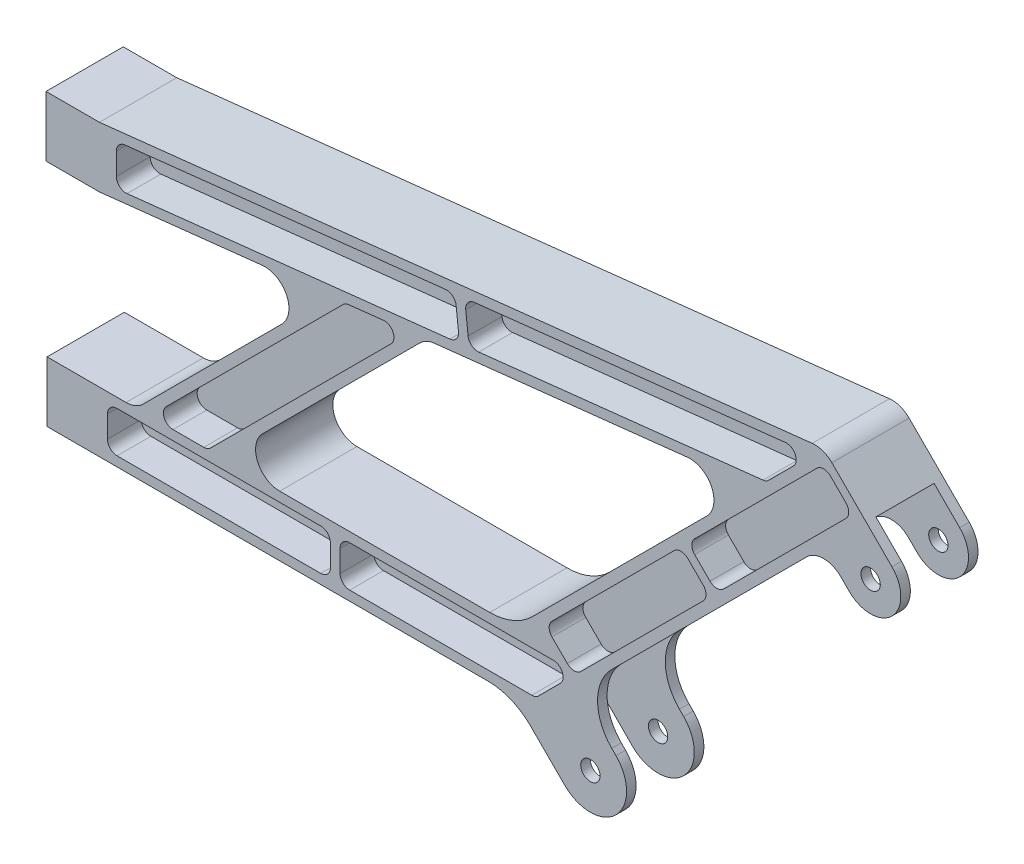
from build123d import *

# Parameters (mm, degrees)
SKETCH1_R               = 4
BOSS_EXTRUDE1_DEPTH     = 32
CUT_EXTRUDE1_DEPTH      = 14
CUT_EXTRUDE2_DEPTH      = 12.0515
CUT_EXTRUDE2_DEPTH_BACK = 12.0515


with BuildPart() as part:
    # Sketch1 → Boss-Extrude1 (new body)
    with BuildSketch(Plane.XY):
        with BuildLine():
            Line((-16.049733998, 33.731487379), (8.839559806, 8.838109599))
            ThreePointArc((8.839559806, 8.838109599), (12.499999987, -0.000512728), (8.838834763, -8.838834767))
            ThreePointArc((8.838834763, -8.838834767), (-2e-09, -12.5), (-8.838834765, -8.838834765))
            Line((-8.838834765, -8.838834765), (-12.374368672, -5.303300858))
            ThreePointArc((-12.374368672, -5.303300858), (-19.445436483, -2.37436867), (-26.516504295, -5.303300858))
            Line((-26.516504295, -5.303300858), (-107.248737345, -86.035533908))
            ThreePointArc((-107.248737345, -86.035533908), (-113.106601722, -100.177669532), (-107.248737345, -114.319805156))
            Line((-107.248737345, -114.319805156), (-105.480970392, -116.087572109))
            ThreePointArc((-105.480970392, -116.087572109), (-101.08757211, -126.694173826), (-105.480970392, -137.300775544))
            ThreePointArc((-105.480970392, -137.300775544), (-116.08757211, -141.694173826), (-126.694173828, -137.300775544))
            Line((-126.694173828, -137.300775544), (-140.832552861, -123.162396511))
            ThreePointArc((-140.832552861, -123.162396511), (-148.943136582, -117.743077728), (-158.510222391, -115.840066041))
            Line((-158.510222391, -115.840066041), (-341.137300972, -115.840066041))
            Line((-341.137300972, -115.840066041), (-341.137300972, -90.840066041))
            Line((-341.137300972, -90.840066041), (-308.412362541, -90.840066041))
            ThreePointArc((-308.412362541, -90.840066041), (-304.585528218, -90.078861366), (-301.34129473, -87.911133852))
            Line((-301.34129473, -87.911133852), (-243.877290013, -30.447129136))
            ThreePointArc((-243.877290013, -30.447129136), (-241.932724982, -19.049588808), (-252.040732039, -13.435904455))
            Line((-252.040732039, -13.435904455), (-319.417601675, -20.840290121))
            Line((-319.417601675, -20.840290121), (-341.577601675, -20.840290121))
            Line((-341.577601675, -20.840290121), (-341.577601675, 4.159709879))
            Line((-341.577601675, 4.159709879), (-319.417601674, 4.159709879))
            Line((-319.417601674, 4.159709879), (-24.213756083, 36.601156542))
            ThreePointArc((-24.213756083, 36.601156542), (-19.80525783, 36.095156835), (-16.049733998, 33.731487379))
        make_face()
        with Locations((-116.08757211, -126.694173826)):
            Circle(SKETCH1_R, mode=Mode.SUBTRACT)
        with Locations((-3e-09, -3e-09)):
            Circle(SKETCH1_R, mode=Mode.SUBTRACT)
        with BuildLine():
            Line((-157.763947596, -90.840066041), (-244.772752235, -90.840066041))
            ThreePointArc((-244.772752235, -90.840066041), (-254.01154756, -84.666900364), (-251.843820046, -73.768998229))
            Line((-251.843820046, -73.768998229), (-186.691765829, -8.616944011))
            ThreePointArc((-186.691765829, -8.616944011), (-183.947170533, -6.67237898), (-180.713072231, -5.747854954))
            Line((-180.713072231, -5.747854954), (-75.981590903, 5.7616183))
            ThreePointArc((-75.981590903, 5.7616183), (-65.873583845, 0.147933947), (-67.818148877, -11.24960638))
            Line((-67.818148877, -11.24960638), (-140.086278067, -83.51773557))
            ThreePointArc((-140.086278067, -83.51773557), (-148.196861787, -88.937054353), (-157.763947596, -90.840066041))
        make_face(mode=Mode.SUBTRACT)
    extrude(amount=BOSS_EXTRUDE1_DEPTH)

    # Sketch2 → Cut-Extrude1 (cut)
    with BuildSketch(Plane.XY.offset(32)):
        with BuildLine():
            ThreePointArc((-140.366977977, -111.840066041), (-138.836244247, -111.535584171), (-137.538550852, -110.668493165))
            Line((-137.538550852, -110.668493165), (-128.538550852, -101.668493165))
            ThreePointArc((-128.538550852, -101.668493165), (-127.671459847, -97.309332311), (-131.366977977, -94.840066041))
            Line((-131.366977977, -94.840066041), (-215.770021637, -94.840066041))
            ThreePointArc((-215.770021637, -94.840066041), (-218.598448762, -96.011638916), (-219.770021637, -98.840066041))
            Line((-219.770021637, -98.840066041), (-219.770021637, -107.840066041))
            ThreePointArc((-219.770021637, -107.840066041), (-218.598448762, -110.668493165), (-215.770021637, -111.840066041))
            Line((-215.770021637, -111.840066041), (-140.366977977, -111.840066041))
        make_face()
        with BuildLine():
            ThreePointArc((-16.614921093, 28.639448842), (-19.443416168, 29.811253755), (-22.272007364, 28.639680883))
            Line((-22.272007364, 28.639680883), (-72.893028462, -21.981340215))
            ThreePointArc((-72.893028462, -21.981340215), (-74.064601337, -24.80976734), (-72.893028462, -27.638194464))
            Line((-72.893028462, -27.638194464), (-66.529067431, -34.002155495))
            ThreePointArc((-66.529067431, -34.002155495), (-63.700640306, -35.17372837), (-60.872213182, -34.002155495))
            Line((-60.872213182, -34.002155495), (-10.251714155, 16.618343532))
            ThreePointArc((-10.251714155, 16.618343532), (-9.080141283, 19.446606586), (-10.251482133, 22.274965741))
            Line((-10.251482133, 22.274965741), (-16.614921093, 28.639448842))
        make_face()
        with BuildLine():
            ThreePointArc((-125.633513656, -93.10660172), (-122.805086531, -94.278174595), (-119.976659407, -93.10660172))
            Line((-119.976659407, -93.10660172), (-69.357494556, -42.487436869))
            ThreePointArc((-69.357494556, -42.487436869), (-68.185921681, -39.659009745), (-69.357494556, -36.83058262))
            Line((-69.357494556, -36.83058262), (-75.721455587, -30.466621589))
            ThreePointArc((-75.721455587, -30.466621589), (-78.549882711, -29.295048714), (-81.378309836, -30.466621589))
            Line((-81.378309836, -30.466621589), (-131.997474687, -81.08578644))
            ThreePointArc((-131.997474687, -81.08578644), (-133.169047562, -83.914213565), (-131.997474687, -86.742640689))
            Line((-131.997474687, -86.742640689), (-125.633513656, -93.10660172))
        make_face()
        with BuildLine():
            ThreePointArc((-316.137300972, -107.840066041), (-314.965728097, -110.668493165), (-312.137300972, -111.840066041))
            Line((-312.137300972, -111.840066041), (-227.770021637, -111.840066041))
            ThreePointArc((-227.770021637, -111.840066041), (-224.941594512, -110.668493165), (-223.770021637, -107.840066041))
            Line((-223.770021637, -107.840066041), (-223.770021637, -98.840066041))
            ThreePointArc((-223.770021637, -98.840066041), (-224.941594512, -96.011638916), (-227.770021637, -94.840066041))
            Line((-227.770021637, -94.840066041), (-312.137300972, -94.840066041))
            ThreePointArc((-312.137300972, -94.840066041), (-314.965728097, -96.011638916), (-316.137300972, -98.840066041))
            Line((-316.137300972, -98.840066041), (-316.137300972, -107.840066041))
        make_face()
        with BuildLine():
            Line((-176.109143129, 15.884521302), (-308.890718748, 1.292481031))
            ThreePointArc((-308.890718748, 1.292481031), (-311.432678153, -0.014105995), (-312.453769063, -2.683581717))
            Line((-312.453769063, -2.683581717), (-312.453769063, -11.737764783))
            ThreePointArc((-312.453769063, -11.737764783), (-311.123244784, -14.716673874), (-308.016819377, -15.713827531))
            Line((-308.016819377, -15.713827531), (-174.252106965, -1.013745374))
            ThreePointArc((-174.252106965, -1.013745374), (-171.568585634, 0.459786528), (-170.712993903, 3.399267059))
            Line((-170.712993903, 3.399267059), (-171.696130696, 12.345408241))
            ThreePointArc((-171.696130696, 12.345408241), (-173.169662598, 15.028929572), (-176.109143129, 15.884521302))
        make_face()
        with BuildLine():
            Line((-42.183809279, 14.384733217), (-32.011769174, 24.556773322))
            ThreePointArc((-32.011769174, 24.556773322), (-31.233943162, 29.115789453), (-35.277145985, 31.361263195))
            Line((-35.277145985, 31.361263195), (-164.180954887, 17.19537036))
            ThreePointArc((-164.180954887, 17.19537036), (-166.864476218, 15.721838457), (-167.720067949, 12.782357926))
            Line((-167.720067949, 12.782357926), (-166.736931156, 3.836216744))
            ThreePointArc((-166.736931156, 3.836216744), (-165.263399254, 1.152695413), (-162.323918722, 0.297103683))
            Line((-162.323918722, 0.297103683), (-44.575286718, 13.237097595))
            ThreePointArc((-44.575286718, 13.237097595), (-43.281647397, 13.606907205), (-42.183809279, 14.384733217))
        make_face()
        with BuildLine():
            ThreePointArc((-216.174337973, -9.644873162), (-217.467977294, -10.014682772), (-218.565815412, -10.792508784))
            Line((-218.565815412, -10.792508784), (-291.784945543, -84.011638916))
            ThreePointArc((-291.784945543, -84.011638916), (-292.652036549, -88.37079977), (-288.956518419, -90.840066041))
            Line((-288.956518419, -90.840066041), (-276.228596357, -90.840066041))
            ThreePointArc((-276.228596357, -90.840066041), (-274.697862628, -90.535584171), (-273.400169233, -89.668493165))
            Line((-273.400169233, -89.668493165), (-198.609611049, -14.877934982))
            ThreePointArc((-198.609611049, -14.877934982), (-197.831785036, -10.318918851), (-201.874987859, -8.07344511))
            Line((-201.874987859, -8.07344511), (-216.174337973, -9.644873162))
        make_face()
    cut_extrude1 = extrude(amount=-CUT_EXTRUDE1_DEPTH, mode=Mode.SUBTRACT)

    # Mirror1: Cut-Extrude1 across plane
    add(cut_extrude1.mirror(Plane.XY.offset(16)), mode=Mode.SUBTRACT)

    # Sketch3 → Cut-Extrude2 (cut, two sides: drawn at the far end of the back side and taken through both)
    with BuildSketch(Plane.XY.offset(16).offset(-CUT_EXTRUDE2_DEPTH_BACK)):
        with BuildLine():
            Line((-158.510222391, -115.840066041), (-141.195405101, -115.840066041))
            ThreePointArc((-141.195405101, -115.840066041), (-137.368570778, -115.078861366), (-134.12433729, -112.911133852))
            Line((-134.12433729, -112.911133852), (-98.96898095, -77.755777513))
            Line((-98.96898095, -77.755777513), (-66.359743398, -110.018550272))
            Line((-66.359743398, -110.018550272), (-116.59713847, -149.218566919))
            Line((-116.59713847, -149.218566919), (-158.510222391, -115.840066041))
        make_face()
        Polygon((-29.015558543, -7.802355106), (7.869814205, 29.083017642), (26.353299235, -15.387889097), (-12.04102058, -17.818970482), align=None)
    extrude(amount=CUT_EXTRUDE2_DEPTH + CUT_EXTRUDE2_DEPTH_BACK, mode=Mode.SUBTRACT)


solid = part.part
